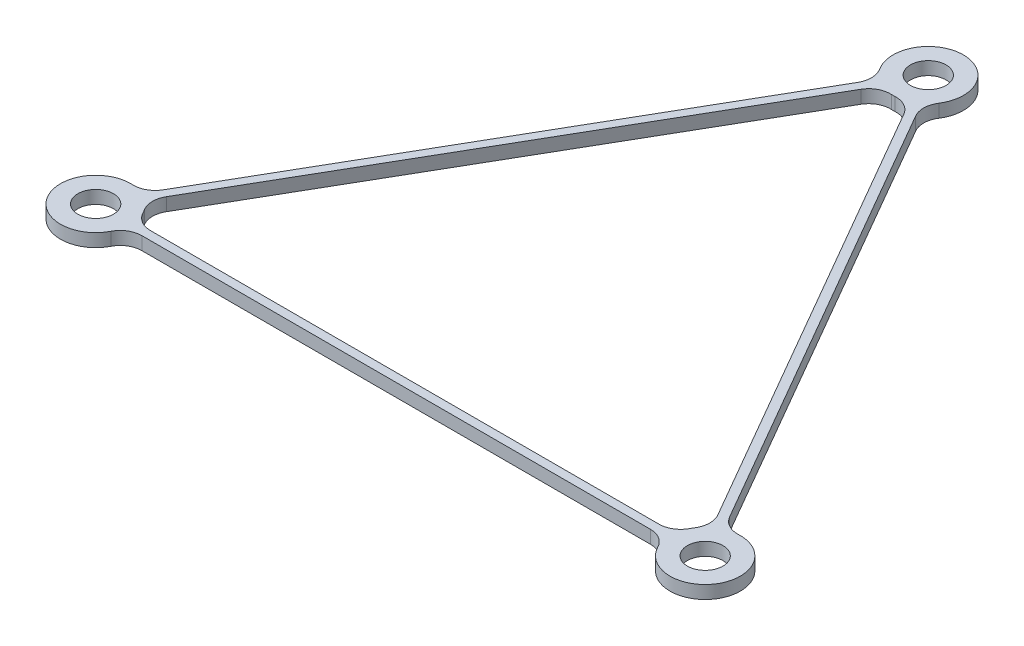
from build123d import *

# Parameters (mm, degrees)
SKETCH2_R        = 2.05
MAIN_SHAPE_DEPTH = 0.75
OUTSIDE_FILLET_R = 2.5
INSIDE_FILLET_R  = 2.5


with BuildPart() as part:
    # Sketch2 → main_shape (new, symmetric)
    with BuildSketch(Plane(origin=(0, 0, 0), x_dir=(1, 0, 0), z_dir=(0, 1, 0))):
        with BuildLine():
            Line((-33.523504055, -16.534423375), (-2.442521348, 37.299417823))
            ThreePointArc((-2.442521348, 37.299417823), (0, 44.579988897), (2.442521348, 37.299417823))
            Line((2.442521348, 37.299417823), (33.523504055, -16.534423375))
            ThreePointArc((33.523504055, -16.534423375), (38.607402885, -22.289994449), (31.080982707, -20.764994449))
            Line((31.080982707, -20.764994449), (-31.080982707, -20.764994449))
            ThreePointArc((-31.080982707, -20.764994449), (-38.607402885, -22.289994449), (-33.523504055, -16.534423375))
        make_face()
        with Locations((0, 40.529988897)):
            Circle(SKETCH2_R, mode=Mode.SUBTRACT)
        with Locations((35.1, -20.264994449)):
            Circle(SKETCH2_R, mode=Mode.SUBTRACT)
        with Locations((-35.1, -20.264994449)):
            Circle(SKETCH2_R, mode=Mode.SUBTRACT)
        with BuildLine():
            Line((-31.080982707, -19.764994449), (31.080982707, -19.764994449))
            ThreePointArc((31.080982707, -19.764994449), (31.592597115, -18.239994449), (32.657478652, -17.034423375))
            Line((32.657478652, -17.034423375), (1.576495945, 36.799417823))
            ThreePointArc((1.576495945, 36.799417823), (0, 36.479988897), (-1.576495945, 36.799417823))
            Line((-1.576495945, 36.799417823), (-32.657478652, -17.034423375))
            ThreePointArc((-32.657478652, -17.034423375), (-31.592597115, -18.239994449), (-31.080982707, -19.764994449))
        make_face(mode=Mode.SUBTRACT)
    extrude(amount=MAIN_SHAPE_DEPTH, both=True)

    # outside_fillet
    outside_fillet_edges = [part.edges().sort_by_distance(p)[0] for p in [
        (-2.442521348, 0, -37.299417823),
        (2.442521348, 0, -37.299417823),
        (33.523504055, 0, 16.534423375),
        (31.080982707, 0, 20.764994449),
        (-31.080982707, 0, 20.764994449),
        (-33.523504055, 0, 16.534423375),
    ]]
    fillet(outside_fillet_edges, radius=OUTSIDE_FILLET_R)

    # inside_fillet
    inside_fillet_edges = [part.edges().sort_by_distance(p)[0] for p in [
        (-32.657478652, 0, 17.034423375),
        (-31.080982707, 0, 19.764994449),
        (31.080982707, 0, 19.764994449),
        (32.657478652, 0, 17.034423375),
        (1.576495945, 0, -36.799417823),
        (-1.576495945, 0, -36.799417823),
    ]]
    fillet(inside_fillet_edges, radius=INSIDE_FILLET_R)


solid = part.part
